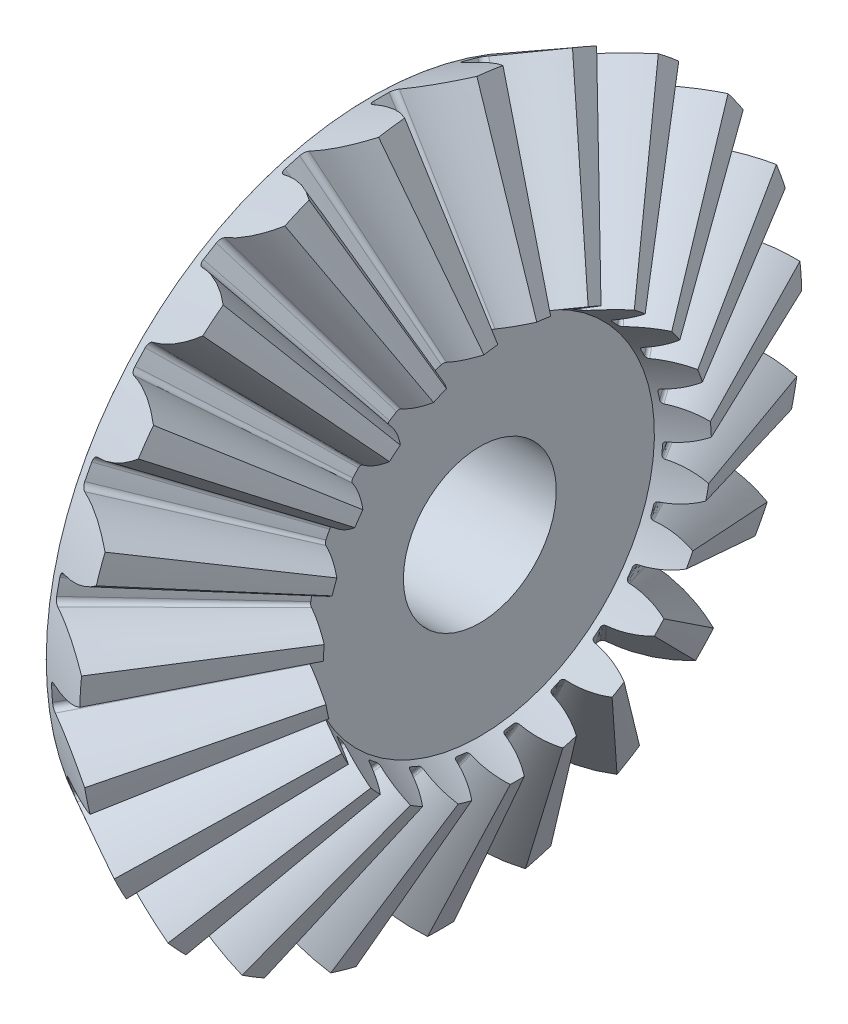
from build123d import *

# Parameters (mm, degrees)
TEETHCUTS_COUNT = 23
TEETHCUTS_ANGLE = 344.347826087
HUBSKE_R        = 10.618937455
HUB_DEPTH       = 0.0001016
BORSKE_R        = 2.5
BORE_DEPTH      = 7.688754012


with BuildPart() as part:
    # BasProSke → Base-Revolve (revolve)
    with BuildSketch(Plane(origin=(0, 0, 0), x_dir=(1, 0, 0), z_dir=(0, 1, 0)), mode=Mode.PRIVATE) as base_revolve_sk:
        Polygon((0, 0), (0, 10.618937457), (2.278474872, 11.807706952), (4.781062584, 6.345863095), (3.556532736, 5.706977959), (3.556532736, 0), align=None)
    revolve(base_revolve_sk.sketch.rotate(Axis((-10, 0, 0), (1, 0, 0)), 180), axis=Axis((-10, 0, 0), (1, 0, 0)))

    # ToothCut: read off the stored shape, not the designer's step
    # ToothCut: loft between two sections, ruled curve by curve
    toothcut_from = [
        Edge.make_bspline([(7.697168927, 0.004416894, -0.008373317), (7.691777948, 0.001604209, -0.015307476), (7.683624559, -0.002649733, -0.014612761), (7.679218312, -0.004948644, -0.006843822)], [0, 0, 0, 0, 1, 1, 1, 1], 3, [1, 0.733871306, 0.733871306, 1]),
        Edge.make_bspline([(7.679218312, -0.004948644, 0.006843822), (7.683624559, -0.002649733, 0.014612761), (7.691777948, 0.001604209, 0.015307476), (7.697168927, 0.004416894, 0.008373317)], [0, 0, 0, 0, 1, 1, 1, 1], 3, [1, 0.733871306, 0.733871306, 1]),
        Edge.make_bspline([(7.679218312, -0.004948644, -0.006843822), (7.678636037, -0.00525244, -0.005817176), (7.678189867, -0.005485224, -0.004707185), (7.677888968, -0.005642215, -0.00353665)], [0, 0, 0, 0, 1, 1, 1, 1], 3, [1, 0.993152267, 0.993152267, 1]),
        Edge.make_bspline([(7.677888968, -0.005642215, 0.00353665), (7.678189867, -0.005485224, 0.004707185), (7.678636037, -0.00525244, 0.005817176), (7.679218312, -0.004948644, 0.006843822)], [0, 0, 0, 0, 1, 1, 1, 1], 3, [1, 0.993152267, 0.993152267, 1]),
        Edge.make_bspline([(7.677888968, -0.005642215, -0.00353665), (7.677291085, -0.005954154, -0.001210814), (7.677291085, -0.005954154, 0.001210814), (7.677888968, -0.005642215, 0.00353665)], [0, 0, 0, 0, 1, 1, 1, 1], 3, [1, 0.973628713, 0.973628713, 1]),
        Edge.make_line((7.697168927, 0.004416894, 0.008373317), (7.697168927, 0.004416894, -0.008373317)),
    ]
    toothcut_to = [
        Edge.make_bspline([(2.431258553, 11.887420176, -1.325283918), (1.857995929, 11.588326634, -0.84031021), (1.19331072, 11.241534352, -0.538291725), (0.482078369, 10.870456605, -0.439618888)], [0, 0, 0, 0, 1, 1, 1, 1], 3, [1, 0.97749539, 0.97749539, 1]),
        Edge.make_bspline([(0.482078369, 10.870456605, 0.439618888), (1.19331072, 11.241534352, 0.538291725), (1.857995929, 11.588326634, 0.84031021), (2.431258553, 11.887420176, 1.325283918)], [0, 0, 0, 0, 1, 1, 1, 1], 3, [1, 0.97749539, 0.97749539, 1]),
        Edge.make_bspline([(0.482078369, 10.870456605, -0.439618888), (0.392033303, 10.823476571, -0.427126484), (0.332772314, 10.792557794, -0.349644473), (0.335021682, 10.793731377, -0.247346572)], [0, 0, 0, 0, 1, 1, 1, 1], 3, [1, 0.82716971, 0.82716971, 1]),
        Edge.make_bspline([(0.335021682, 10.793731377, 0.247346572), (0.332772314, 10.792557794, 0.349644473), (0.392033303, 10.823476571, 0.427126484), (0.482078369, 10.870456605, 0.439618888)], [0, 0, 0, 0, 1, 1, 1, 1], 3, [1, 0.82716971, 0.82716971, 1]),
        Edge.make_bspline([(0.335021682, 10.793731377, -0.247346572), (0.338647149, 10.795622925, -0.082465758), (0.338647149, 10.795622925, 0.082465758), (0.335021682, 10.793731377, 0.247346572)], [0, 0, 0, 0, 1, 1, 1, 1], 3, [1, 0.999795061, 0.999795061, 1]),
        Edge.make_line((2.431258553, 11.887420176, 1.325283918), (2.431258553, 11.887420176, -1.325283918)),
    ]
    toothcut = Solid(Shell([*[Face.make_surface_from_curves(toothcut_from[k], toothcut_to[k]) for k in range(6)], Face(Wire(toothcut_from)), Face(Wire(toothcut_to))]))
    add(toothcut, mode=Mode.SUBTRACT)

    # TeethCuts: ToothCut ×23 about axis
    teethcuts_axis = Axis((-10, 0, 0), (1, 0, 0))
    for i in range(1, TEETHCUTS_COUNT):
        add(toothcut.rotate(teethcuts_axis, i * TEETHCUTS_ANGLE / (TEETHCUTS_COUNT - 1)), mode=Mode.SUBTRACT)

    # HubSke → Hub (add)
    with BuildSketch(Plane.ZY):
        Circle(HUBSKE_R)
    extrude(amount=HUB_DEPTH)

    # BorSke → Bore (cut, symmetric)
    with BuildSketch(Plane(origin=(0, 0, 0), x_dir=(0, 0, -1), z_dir=(1, 0, 0))):
        with Locations(Location((0, 0, 0), (0, 0, 180))):
            Circle(BORSKE_R)
    extrude(amount=BORE_DEPTH, both=True, mode=Mode.SUBTRACT)


solid = part.part
